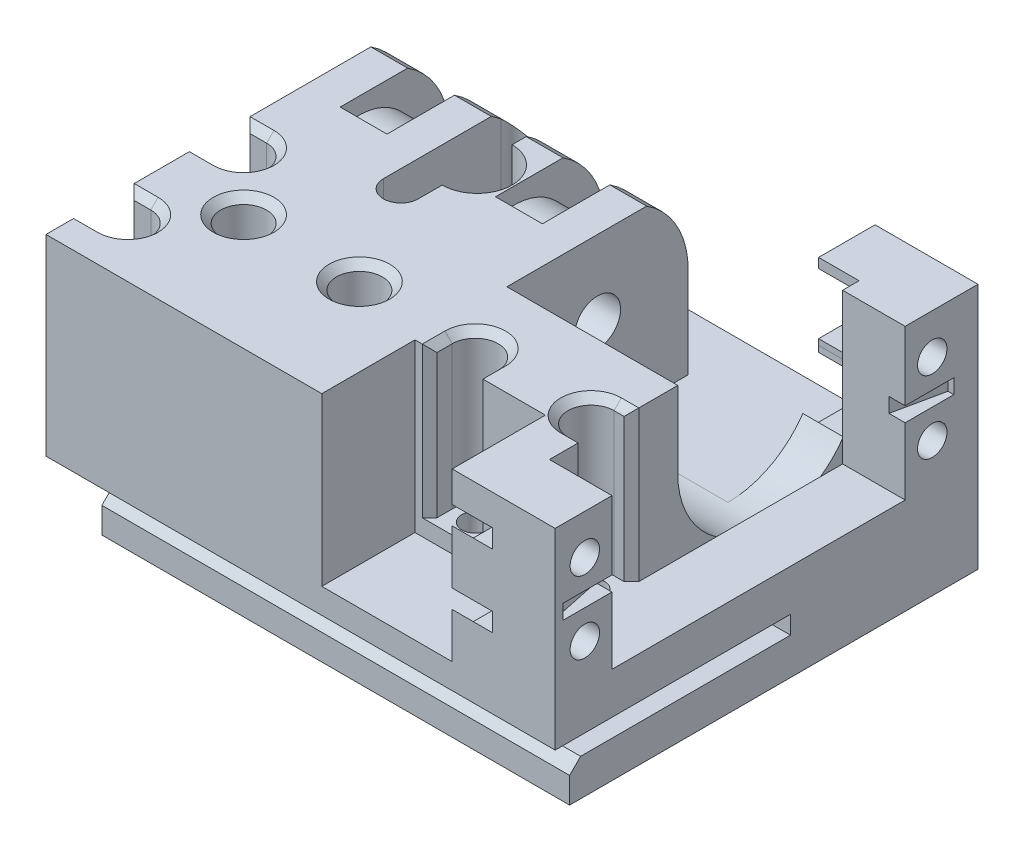
from build123d import *

# Parameters (mm, degrees)
SKETCH3_R                      = 3.175
BOSS_EXTRUDE1_DEPTH            = 19.05
SKETCH4_W                      = 83.82
SKETCH4_H                      = 19.05
BOSS_EXTRUDE2_DEPTH            = 32.24022
SKETCH5_W                      = 18.27022
SKETCH5_H                      = 5.345
CUT_EXTRUDE1_DEPTH             = 102.496990436
SKETCH6_W                      = 18.27022
SKETCH6_H                      = 20.32
CUT_EXTRUDE2_DEPTH             = 86.487406486
CUT_EXTRUDE3_REACH             = 87.958
SKETCH7_W                      = 26.743216354
SKETCH7_H                      = 34.182432708
CUT_EXTRUDE3_DIRECTION_2_DEPTH = 2.54
CUT_EXTRUDE4_DEPTH             = 91.51042864
SKETCH9_R                      = 4.826
CUT_EXTRUDE5_DEPTH             = 10.53
SKETCH10_W                     = 14.224
SKETCH10_H                     = 63.5
BOSS_EXTRUDE3_DEPTH            = 25.4
SKETCH11_W                     = 40.50800001
SKETCH11_H                     = 23.485136833
CUT_EXTRUDE6_DEPTH             = 8.636
CUT_EXTRUDE7_DEPTH             = 5.588
CUT_EXTRUDE8_DEPTH             = 99.107882225
SKETCH15_W                     = 52.07
SKETCH15_H                     = 26.53
BOSS_EXTRUDE4_DEPTH            = 18.01622
DELETEFACE1_OUTLINE_W          = 4.04622
DELETEFACE1_OUTLINE_H          = 6.35
DELETEFACE1_DEPTH              = 5.345
CUT_EXTRUDE9_START             = -18.01622
SKETCH17_W                     = 12.876
SKETCH17_H                     = 23.054
CUT_EXTRUDE9_DEPTH             = 18.01622
CUT_EXTRUDE10_DEPTH            = 60.568280192
CUT_EXTRUDE11_START            = -5.08
SKETCH23_W                     = 6.477
SKETCH23_H                     = 24.765
CUT_EXTRUDE11_DEPTH            = 16.37
SKETCH24_W                     = 18.01622
SKETCH24_H                     = 5.976
SKETCH24_W_2                   = 6.477
SKETCH24_W_3                   = 4.826
SKETCH24_W_4                   = 4.064
CUT_EXTRUDE12_DEPTH            = 20.832
CUT_EXTRUDE13_START            = -5.08
CUT_EXTRUDE13_DEPTH            = 6.477
CUT_EXTRUDE14_START            = -11.557
CUT_EXTRUDE14_DEPTH            = 6.477
CUT_EXTRUDE15_DEPTH            = 18.01622
BOSS_EXTRUDE5_REACH            = 74.428
SKETCH29_R                     = 7.239
SKETCH30_R                     = 3.175
CUT_EXTRUDE16_DEPTH            = 20.784000066
SKETCH31_R                     = 1.85
CUT_EXTRUDE17_DEPTH            = 5.745999934
CUT_EXTRUDE18_DEPTH            = 7.366
SKETCH33_W                     = 7.698188609
SKETCH33_H                     = 8.382
CUT_EXTRUDE19_DEPTH            = 6.858
CHAMFER1_SIZE                  = 1.016
CUT_EXTRUDE20_DEPTH            = 1.651
CUT_EXTRUDE20_DEPTH_BACK       = 0.381
CUT_EXTRUDE21_REACH            = 85.932
SKETCH35_R                     = 2.032
CUT_EXTRUDE22_DEPTH            = 5.588
DRAFT1_START                   = -19.05
DRAFT1_DEPTH                   = 5.08
DRAFT1_START_2                 = -7.493
DRAFT1_2_DEPTH                 = 5.08
DRAFT1_START_3                 = 2.413
DRAFT1_3_DEPTH                 = 5.08
DRAFT1_START_4                 = 13.97
DRAFT1_4_DEPTH                 = 5.08


# Read off the part's stored shape, not the designer's step: DeleteFace1, Draft1
with BuildPart() as part:
    # Sketch3 → Boss-Extrude1 (new, symmetric)
    with BuildSketch(Plane(origin=(0, 0, 0), x_dir=(0, 0, -1), z_dir=(1, 0, 0))):
        Polygon((-63.5, 5.345), (-63.5, -13.705), (20.32, -13.705), (20.32, 5.345), (13.97, 5.345), (13.97, 25.4), (-38.1, 25.4), (-38.1, 5.345), align=None)
        with Locations(Location((0, 14.87, 0), (0, 0, 180))):
            Circle(SKETCH3_R, mode=Mode.SUBTRACT)
    extrude(amount=BOSS_EXTRUDE1_DEPTH, both=True)

    # Sketch4 → Boss-Extrude2 (add)
    with BuildSketch(Plane(origin=(19.05, 0, 0), x_dir=(0, 0, -1), z_dir=(1, 0, 0))):
        with Locations((-21.59, -4.18)):
            Rectangle(SKETCH4_W, SKETCH4_H)
    extrude(amount=BOSS_EXTRUDE2_DEPTH)

    # Sketch5 → Cut-Extrude1 (cut, through all)
    with BuildSketch(Plane.XY.offset(63.5)):
        with Locations((42.15511, 2.6725)):
            Rectangle(SKETCH5_W, SKETCH5_H)
    extrude(amount=-CUT_EXTRUDE1_DEPTH, mode=Mode.SUBTRACT)

    # Sketch6 → Cut-Extrude2 (cut, through all)
    with BuildSketch(Plane(origin=(0, 0, 0), x_dir=(1, 0, 0), z_dir=(0, 1, 0))):
        with Locations((42.15511, -53.34)):
            Rectangle(SKETCH6_W, SKETCH6_H)
    extrude(amount=-CUT_EXTRUDE2_DEPTH, mode=Mode.SUBTRACT)

    # Cut-Extrude3: up to this face of the body (flat: up to its plane)
    cut_extrude3_end = Plane(part.part.faces().sort_by_distance((19.05, 15.388215846, 12.442336691))[0])
    # Sketch7 → Cut-Extrude3 (cut, up to the picked face)
    with BuildSketch(Plane(origin=(33.02, 0, 0), x_dir=(0, 0, -1), z_dir=(1, 0, 0)), mode=Mode.PRIVATE) as cut_extrude3_sk1:
        with Locations((-2.195608177, 14.87)):
            Rectangle(SKETCH7_W, SKETCH7_H)
    cut_extrude3_tool1 = split(extrude(cut_extrude3_sk1.sketch, amount=-CUT_EXTRUDE3_REACH, mode=Mode.PRIVATE), bisect_by=cut_extrude3_end, keep=Keep.BOTH, mode=Mode.PRIVATE)
    add(cut_extrude3_tool1.solids().sort_by(Axis((33.02, 14.87, 2.195608), (-1, 0, 0)))[0], mode=Mode.SUBTRACT)

    # Sketch7 → Cut-Extrude3 direction 2 (cut)
    with BuildSketch(Plane(origin=(33.02, 0, 0), x_dir=(0, 0, -1), z_dir=(1, 0, 0))):
        with Locations((-2.195608177, 14.87)):
            Rectangle(SKETCH7_W, SKETCH7_H)
    extrude(amount=CUT_EXTRUDE3_DIRECTION_2_DEPTH, mode=Mode.SUBTRACT)

    # Sketch8 → Cut-Extrude4 (cut, through all)
    with BuildSketch(Plane(origin=(0, 25.4, 0), x_dir=(1, 0, 0), z_dir=(0, 1, 0))):
        with BuildLine():
            Line((2.413, 8.128), (2.413, -8.128))
            ThreePointArc((2.413, -8.128), (0, -10.541), (-2.413, -8.128))
            Line((-2.413, -8.128), (-2.413, 8.128))
            ThreePointArc((-2.413, 8.128), (0, 10.541), (2.413, 8.128))
        make_face()
    extrude(amount=-CUT_EXTRUDE4_DEPTH, mode=Mode.SUBTRACT)

    # Sketch9 → Cut-Extrude5 (cut)
    with BuildSketch(Plane(origin=(0, 25.4, 0), x_dir=(1, 0, 0), z_dir=(0, 1, 0))):
        with Locations((2.413, 0)):
            Circle(SKETCH9_R)
    extrude(amount=-CUT_EXTRUDE5_DEPTH, mode=Mode.SUBTRACT)

    # Sketch10 → Boss-Extrude3 (add)
    with BuildSketch(Plane(origin=(0, 0, 0), x_dir=(1, 0, 0), z_dir=(0, 1, 0))):
        with Locations((44.17822, -11.43)):
            Rectangle(SKETCH10_W, SKETCH10_H)
    extrude(amount=BOSS_EXTRUDE3_DEPTH)

    # Sketch11 → Cut-Extrude6 (cut)
    with BuildSketch(Plane(origin=(51.29022, 0, 0), x_dir=(0, 0, -1), z_dir=(1, 0, 0))):
        with Locations((-9.999999939, 16.358568351)):
            Rectangle(SKETCH11_W, SKETCH11_H)
    extrude(amount=-CUT_EXTRUDE6_DEPTH, mode=Mode.SUBTRACT)

    # Sketch12 → Cut-Extrude7 (cut)
    with BuildSketch(Plane.ZY.offset(-37.06622)):
        with BuildLine():
            Line((12.524, 14.87), (12.524, 39.918))
            Line((12.524, 39.918), (-12.524, 39.918))
            Line((-12.524, 39.918), (-12.524, 14.87))
            ThreePointArc((-12.524, 14.87), (0, 2.346), (12.524, 14.87))
        make_face()
    extrude(amount=-CUT_EXTRUDE7_DEPTH, mode=Mode.SUBTRACT)

    # Sketch14 → Cut-Extrude8 (cut, through all)
    with BuildSketch(Plane.ZY.offset(19.05)):
        Polygon((5.592, -1.13), (5.592, -3.63), (34.576, -3.63), (36.1, -5.154), (36.1, -8.71), (-24.526326305, -8.71), (-24.526326305, -20.708004014), (63.5, -20.708004014), (63.5, 33.786418234), (38.1, 33.786418234), (38.1, -1.13), align=None)
    extrude(amount=-CUT_EXTRUDE8_DEPTH, mode=Mode.SUBTRACT)

    # Sketch15 → Boss-Extrude4 (add)
    with BuildSketch(Plane(origin=(19.05, 0, 0), x_dir=(0, 0, -1), z_dir=(1, 0, 0))):
        with Locations((-12.065, 12.135)):
            Rectangle(SKETCH15_W, SKETCH15_H)
    extrude(amount=BOSS_EXTRUDE4_DEPTH)

    # DeleteFace1 outline → DeleteFace1 (add)
    with BuildSketch(Plane(origin=(0, 0, 0), x_dir=(1, 0, 0), z_dir=(0, 1, 0))):
        with Locations((35.04311, 17.145)):
            Rectangle(DELETEFACE1_OUTLINE_W, DELETEFACE1_OUTLINE_H)
    extrude(amount=DELETEFACE1_DEPTH)

    # Sketch17 → Cut-Extrude9 (cut)
    with BuildSketch(Plane(origin=(37.06622, 0, 0), x_dir=(0, 0, -1), z_dir=(1, 0, 0)).offset(CUT_EXTRUDE9_START)):
        with BuildLine():
            Line((-12.524, 25.4), (38.058416854, 25.4))
            Line((38.058416854, 25.4), (38.058416854, 2.346))
            Line((38.058416854, 2.346), (0, 2.346))
            ThreePointArc((0, 2.346), (-8.855805328, 6.014194672), (-12.524, 14.87))
            Line((-12.524, 14.87), (-12.524, 25.4))
        make_face()
        with Locations((-31.662, 13.873)):
            Rectangle(SKETCH17_W, SKETCH17_H)
    extrude(amount=CUT_EXTRUDE9_DEPTH, mode=Mode.SUBTRACT)

    # Sketch18 → Cut-Extrude10 (cut, through all)
    with BuildSketch(Plane(origin=(19.05, 0, 0), x_dir=(0, 0, -1), z_dir=(1, 0, 0))):
        with BuildLine():
            Line((12.524, 14.87), (12.524, 2.346))
            Line((12.524, 2.346), (28.306113681, 2.346))
            Line((28.306113681, 2.346), (28.306113681, 27.20416072))
            Line((28.306113681, 27.20416072), (2.172338676, 27.20416072))
            ThreePointArc((2.172338676, 27.20416072), (9.593147179, 22.921217499), (12.524, 14.87))
        make_face()
    extrude(amount=-CUT_EXTRUDE10_DEPTH, mode=Mode.SUBTRACT)

    # Sketch23 → Cut-Extrude11 (cut)
    with BuildSketch(Plane(origin=(0, 25.4, 0), x_dir=(1, 0, 0), z_dir=(0, 1, 0)).offset(CUT_EXTRUDE11_START)):
        with Locations((-10.7315, -20.6375)):
            Rectangle(SKETCH23_W, SKETCH23_H)
        with BuildLine():
            Line((-2.413, -15.221833942), (-2.413, -33.02))
            Line((-2.413, -33.02), (2.413, -33.02))
            Line((2.413, -33.02), (2.413, -15.221833942))
            ThreePointArc((2.413, -15.221833942), (0, -15.621), (-2.413, -15.221833942))
        make_face()
        with Locations((10.7315, -20.6375)):
            Rectangle(SKETCH23_W, SKETCH23_H)
    extrude(amount=-CUT_EXTRUDE11_DEPTH, mode=Mode.SUBTRACT)

    # Sketch24 → Cut-Extrude12 (cut)
    with BuildSketch(Plane(origin=(0, 0, -20.32), x_dir=(-1, 0, 0), z_dir=(0, 0, -1))):
        with Locations((-28.05811, -5.722)):
            Rectangle(SKETCH24_W, SKETCH24_H)
        with Locations((-10.7315, -5.722)):
            Rectangle(SKETCH24_W_2, SKETCH24_H)
        with Locations((0, -5.722)):
            Rectangle(SKETCH24_W_3, SKETCH24_H)
        with Locations((10.7315, -5.722)):
            Rectangle(SKETCH24_W_2, SKETCH24_H)
        with Locations((-44.17822, -5.722)):
            Rectangle(SKETCH24_W_4, SKETCH24_H)
    extrude(amount=-CUT_EXTRUDE12_DEPTH, mode=Mode.SUBTRACT)

    # Sketch25 → Cut-Extrude13 (cut)
    with BuildSketch(Plane.ZY.offset(19.05).offset(CUT_EXTRUDE13_START)):
        with BuildLine():
            Line((-2.54, 2.346), (-12.524, 2.346))
            Line((-12.524, 2.346), (-12.524, 30.242497428))
            Line((-12.524, 30.242497428), (2.54, 27.697802569))
            Line((2.54, 27.697802569), (2.54, 22.724516217))
            ThreePointArc((2.54, 22.724516217), (-7.854516217, 17.41), (-2.54, 7.015483783))
            Line((-2.54, 7.015483783), (-2.54, 2.346))
        make_face()
        with BuildLine():
            Line((2.54, 7.015483783), (2.54, 3.95))
            Line((2.54, 3.95), (9.525, 3.95))
            Line((9.525, 3.95), (9.525, 20.32))
            Line((9.525, 20.32), (6.200203626, 20.32))
            ThreePointArc((6.200203626, 20.32), (7.959291915, 12.680320296), (2.54, 7.015483783))
        make_face()
    extrude(amount=-CUT_EXTRUDE13_DEPTH, mode=Mode.SUBTRACT)

    # Sketch26 → Cut-Extrude14 (cut)
    with BuildSketch(Plane(origin=(19.05, 0, 0), x_dir=(0, 0, -1), z_dir=(1, 0, 0)).offset(CUT_EXTRUDE14_START)):
        with BuildLine():
            Line((12.524, 30.242497428), (-2.54, 27.697802569))
            Line((-2.54, 27.697802569), (-2.54, 22.724516217))
            ThreePointArc((-2.54, 22.724516217), (7.854516217, 17.41), (2.54, 7.015483783))
            Line((2.54, 7.015483783), (2.54, 2.346))
            Line((2.54, 2.346), (12.524, 2.346))
            Line((12.524, 2.346), (12.524, 30.242497428))
        make_face()
    extrude(amount=CUT_EXTRUDE14_DEPTH, mode=Mode.SUBTRACT)

    # Sketch27 → Cut-Extrude15 (cut)
    with BuildSketch(Plane.ZY.offset(-37.06622)):
        with BuildLine():
            Line((17.604, 14.87), (17.604, 20.32))
            Line((17.604, 20.32), (20.144, 20.32))
            Line((20.144, 20.32), (20.144, 3.95))
            Line((20.144, 3.95), (13.80776651, 3.95))
            ThreePointArc((13.80776651, 3.95), (16.627879264, 9.089476911), (17.604, 14.87))
        make_face()
    extrude(amount=CUT_EXTRUDE15_DEPTH, mode=Mode.SUBTRACT)

    # Boss-Extrude5: up to this face of the body (flat: up to its plane)
    boss_extrude5_end = Plane(part.part.faces().sort_by_distance((28.05811, 2.346, 31.662))[0])
    # Sketch29 → Boss-Extrude5 (add, up to the picked face)
    with BuildSketch(Plane(origin=(0, 25.4, 0), x_dir=(1, 0, 0), z_dir=(0, 1, 0)), mode=Mode.PRIVATE) as boss_extrude5_sk1:
        with Locations((8.25, -22.1)):
            Circle(SKETCH29_R)
    boss_extrude5_tool1 = split(extrude(boss_extrude5_sk1.sketch, amount=-BOSS_EXTRUDE5_REACH, mode=Mode.PRIVATE), bisect_by=boss_extrude5_end, keep=Keep.BOTH, mode=Mode.PRIVATE)
    # Sketch29 → Boss-Extrude5 (add, up to the picked face)
    with BuildSketch(Plane(origin=(0, 25.4, 0), x_dir=(1, 0, 0), z_dir=(0, 1, 0)), mode=Mode.PRIVATE) as boss_extrude5_sk2:
        with BuildLine():
            Line((-19.05, -7.65693233), (-19.05, -20.54306767))
            ThreePointArc((-19.05, -20.54306767), (-17.052292081, -21.220895754), (-14.943988181, -21.293988181))
            ThreePointArc((-14.943988181, -21.293988181), (-14.989, -22.1), (-14.943988181, -22.906011819))
            ThreePointArc((-14.943988181, -22.906011819), (-17.052292081, -22.979104246), (-19.05, -23.65693233))
            Line((-19.05, -23.65693233), (-19.05, -36.54306767))
            ThreePointArc((-19.05, -36.54306767), (-11.635625886, -36.056093237), (-8.556011819, -29.293988181))
            ThreePointArc((-8.556011819, -29.293988181), (-0.511, -22.1), (-8.556011819, -14.906011819))
            ThreePointArc((-8.556011819, -14.906011819), (-11.635625886, -8.143906763), (-19.05, -7.65693233))
        make_face()
    boss_extrude5_tool2 = split(extrude(boss_extrude5_sk2.sketch, amount=-BOSS_EXTRUDE5_REACH, mode=Mode.PRIVATE), bisect_by=boss_extrude5_end, keep=Keep.BOTH, mode=Mode.PRIVATE)
    # Sketch29 → Boss-Extrude5 (add, up to the picked face)
    with BuildSketch(Plane(origin=(0, 25.4, 0), x_dir=(1, 0, 0), z_dir=(0, 1, 0)), mode=Mode.PRIVATE) as boss_extrude5_sk3:
        with BuildLine():
            Line((42.65422, -25.224), (42.65422, -15.2719075))
            ThreePointArc((42.65422, -15.2719075), (34.863256938, -17.264080214), (33.719782163, -25.224))
            Line((33.719782163, -25.224), (42.65422, -25.224))
        make_face()
    boss_extrude5_tool3 = split(extrude(boss_extrude5_sk3.sketch, amount=-BOSS_EXTRUDE5_REACH, mode=Mode.PRIVATE), bisect_by=boss_extrude5_end, keep=Keep.BOTH, mode=Mode.PRIVATE)
    # Sketch29 → Boss-Extrude5 (add, up to the picked face)
    with BuildSketch(Plane(origin=(0, 25.4, 0), x_dir=(1, 0, 0), z_dir=(0, 1, 0)), mode=Mode.PRIVATE) as boss_extrude5_sk4:
        with BuildLine():
            Line((17.719782163, -25.224), (30.780217837, -25.224))
            ThreePointArc((30.780217837, -25.224), (24.25, -14.861), (17.719782163, -25.224))
        make_face()
    boss_extrude5_tool4 = split(extrude(boss_extrude5_sk4.sketch, amount=-BOSS_EXTRUDE5_REACH, mode=Mode.PRIVATE), bisect_by=boss_extrude5_end, keep=Keep.BOTH, mode=Mode.PRIVATE)
    add(boss_extrude5_tool1.solids().sort_by(Axis((8.25, 25.4, 22.1), (0, -1, 0)))[0])
    add(boss_extrude5_tool2.solids().sort_by(Axis((-11.781136, 25.4, 22.1), (0, -1, 0)))[0])
    add(boss_extrude5_tool3.solids().sort_by(Axis((38.266183, 25.4, 20.482323), (0, -1, 0)))[0])
    add(boss_extrude5_tool4.solids().sort_by(Axis((24.25, 25.4, 20.627742), (0, -1, 0)))[0])

    # Sketch30 → Cut-Extrude16 (cut)
    with BuildSketch(Plane(origin=(0, 25.4, 0), x_dir=(1, 0, 0), z_dir=(0, 1, 0))):
        with Locations(Location((-7.75, -22.1, 0), (0, 0, 270))):
            Circle(SKETCH30_R)
        with Locations(Location((8.25, -22.1, 0), (0, 0, 270))):
            Circle(SKETCH30_R)
        with BuildLine():
            Line((-15.75, -17.275), (-24.660137831, -17.275))
            ThreePointArc((-24.660137831, -17.275), (-27.835137831, -14.1), (-24.660137831, -10.925))
            Line((-24.660137831, -10.925), (-15.75, -10.925))
            ThreePointArc((-15.75, -10.925), (-12.575, -14.1), (-15.75, -17.275))
        make_face()
        with BuildLine():
            Line((-15.75, -33.275), (-24.156487658, -33.275))
            ThreePointArc((-24.156487658, -33.275), (-27.331487658, -30.1), (-24.156487658, -26.925))
            Line((-24.156487658, -26.925), (-15.75, -26.925))
            ThreePointArc((-15.75, -26.925), (-12.575, -30.1), (-15.75, -33.275))
        make_face()
        with BuildLine():
            Line((27.425, -22.1), (27.425, -30.1))
            ThreePointArc((27.425, -30.1), (24.25, -33.275), (21.075, -30.1))
            Line((21.075, -30.1), (21.075, -22.1))
            ThreePointArc((21.075, -22.1), (24.25, -18.925), (27.425, -22.1))
        make_face()
        with BuildLine():
            Line((40.25, -18.925), (45.803319647, -18.925))
            ThreePointArc((45.803319647, -18.925), (48.978319647, -22.1), (45.803319647, -25.275))
            Line((45.803319647, -25.275), (40.25, -25.275))
            ThreePointArc((40.25, -25.275), (37.075, -22.1), (40.25, -18.925))
        make_face()
    extrude(amount=-CUT_EXTRUDE16_DEPTH, mode=Mode.SUBTRACT)

    # Sketch31 → Cut-Extrude17 (cut)
    with BuildSketch(Plane(origin=(0, 4.615999934, 0), x_dir=(1, 0, 0), z_dir=(0, 1, 0))):
        with Locations(Location((40.25, -22.1, 0), (0, 0, 270))):
            Circle(SKETCH31_R)
        with Locations(Location((24.25, -22.1, 0), (0, 0, 270))):
            Circle(SKETCH31_R)
        with Locations(Location((8.25, -22.1, 0), (0, 0, 270))):
            Circle(SKETCH31_R)
        with Locations(Location((-7.75, -22.1, 0), (0, 0, 270))):
            Circle(SKETCH31_R)
        with Locations(Location((-15.75, -14.1, 0), (0, 0, 270))):
            Circle(SKETCH31_R)
        with Locations(Location((-15.75, -30.1, 0), (0, 0, 270))):
            Circle(SKETCH31_R)
    extrude(amount=-CUT_EXTRUDE17_DEPTH, mode=Mode.SUBTRACT)

    # Sketch32 → Cut-Extrude18 (cut)
    with BuildSketch(Plane(origin=(0, -3.63, 0), x_dir=(1, 0, 0), z_dir=(0, 1, 0))):
        Polygon((-5.330325022, -17.909), (-10.169674978, -17.909), (-12.589349956, -22.1), (-10.169674978, -26.291), (-5.330325022, -26.291), (-2.910650044, -22.1), align=None)
        Polygon((-20.589349956, -14.1), (-18.169674978, -18.291), (-13.330325022, -18.291), (-10.910650044, -14.1), (-13.330325022, -9.909), (-18.169674978, -9.909), align=None)
        Polygon((-18.169674978, -34.291), (-13.330325022, -34.291), (-10.910650044, -30.1), (-13.330325022, -25.909), (-18.169674978, -25.909), (-20.589349956, -30.1), align=None)
        Polygon((13.089349956, -22.1), (10.669674978, -17.909), (5.830325022, -17.909), (3.410650044, -22.1), (5.830325022, -26.291), (10.669674978, -26.291), align=None)
        Polygon((29.089349956, -22.1), (26.669674978, -17.909), (21.830325022, -17.909), (19.410650044, -22.1), (21.830325022, -26.291), (26.669674978, -26.291), align=None)
        Polygon((45.089349956, -22.1), (42.669674978, -17.909), (37.830325022, -17.909), (35.410650044, -22.1), (37.830325022, -26.291), (42.669674978, -26.291), align=None)
    extrude(amount=-CUT_EXTRUDE18_DEPTH, mode=Mode.SUBTRACT)

    # Sketch33 → Cut-Extrude19 (cut)
    with BuildSketch(Plane.XZ.offset(8.71)):
        Polygon((-18.169674978, 25.909), (-13.330325022, 34.291), (-13.330325022, 40.102605085), (-25.867863587, 40.102605085), (-25.867863587, 25.909), align=None)
        with Locations((-22.018769283, 14.1)):
            Rectangle(SKETCH33_W, SKETCH33_H)
    extrude(amount=-CUT_EXTRUDE19_DEPTH, mode=Mode.SUBTRACT)

    # Chamfer1
    chamfer1_edges = [part.edges().sort_by_distance(p)[0] for p in [
        (-19.05, 15.007999967, 17.275),
        (-19.05, 15.007999967, 10.925),
        (-17.4, 25.4, 10.925),
        (-17.4, 25.4, 17.275),
        (-12.575, 25.4, 14.1),
        (27.425, 15.007999967, 25.224),
        (21.075, 15.007999967, 25.224),
        (-19.05, 15.007999967, 33.275),
        (-19.05, 15.007999967, 26.925),
        (-17.4, 25.4, 26.925),
        (-17.4, 25.4, 33.275),
        (-12.575, 25.4, 30.1),
        (-7.75, 25.4, 18.925),
        (8.25, 25.4, 18.925),
        (21.075, 25.4, 23.662),
        (27.425, 25.4, 23.662),
        (24.25, 25.4, 18.925),
        (41.45211, 25.4, 25.275),
        (41.45211, 25.4, 18.925),
        (37.075, 25.4, 22.1),
        (42.65422, 15.007999967, 25.275),
        (42.65422, 15.007999967, 18.925),
    ]]
    chamfer(chamfer1_edges, length=CHAMFER1_SIZE)

    # Sketch34 → Cut-Extrude20 (cut, two sides: drawn at the far end of the back side and taken through both)
    with BuildSketch(Plane(origin=(0, 14.245, 0), x_dir=(1, 0, 0), z_dir=(0, 1, 0)).offset(-CUT_EXTRUDE20_DEPTH_BACK)):
        Polygon((48.858728421, -29.331541325), (54.634333156, -29.331541325), (54.634333156, -36.981), (50.481340867, -36.981), align=None)
        Polygon((54.419424916, 16.981), (50.481340867, 16.981), (48.801251133, 9.060576966), (54.419424916, 9.060576966), align=None)
    extrude(amount=CUT_EXTRUDE20_DEPTH + CUT_EXTRUDE20_DEPTH_BACK, mode=Mode.SUBTRACT)

    # Cut-Extrude21: up to this face of the body (flat: up to its plane)
    cut_extrude21_end = Plane(part.part.faces().sort_by_distance((37.06622, 13.873, 31.662))[0])
    # Sketch35 → Cut-Extrude21 (cut, up to the picked face)
    with BuildSketch(Plane(origin=(51.29022, 0, 0), x_dir=(0, 0, -1), z_dir=(1, 0, 0)), mode=Mode.PRIVATE) as cut_extrude21_sk1:
        with Locations((-34, 19.87)):
            Circle(SKETCH35_R)
    cut_extrude21_tool1 = split(extrude(cut_extrude21_sk1.sketch, amount=-CUT_EXTRUDE21_REACH, mode=Mode.PRIVATE), bisect_by=cut_extrude21_end, keep=Keep.BOTH, mode=Mode.PRIVATE)
    # Sketch35 → Cut-Extrude21 (cut, up to the picked face)
    with BuildSketch(Plane(origin=(51.29022, 0, 0), x_dir=(0, 0, -1), z_dir=(1, 0, 0)), mode=Mode.PRIVATE) as cut_extrude21_sk2:
        with Locations((-34, 9.87)):
            Circle(SKETCH35_R)
    cut_extrude21_tool2 = split(extrude(cut_extrude21_sk2.sketch, amount=-CUT_EXTRUDE21_REACH, mode=Mode.PRIVATE), bisect_by=cut_extrude21_end, keep=Keep.BOTH, mode=Mode.PRIVATE)
    # Sketch35 → Cut-Extrude21 (cut, up to the picked face)
    with BuildSketch(Plane(origin=(51.29022, 0, 0), x_dir=(0, 0, -1), z_dir=(1, 0, 0)), mode=Mode.PRIVATE) as cut_extrude21_sk3:
        with Locations((14, 19.87)):
            Circle(SKETCH35_R)
    cut_extrude21_tool3 = split(extrude(cut_extrude21_sk3.sketch, amount=-CUT_EXTRUDE21_REACH, mode=Mode.PRIVATE), bisect_by=cut_extrude21_end, keep=Keep.BOTH, mode=Mode.PRIVATE)
    # Sketch35 → Cut-Extrude21 (cut, up to the picked face)
    with BuildSketch(Plane(origin=(51.29022, 0, 0), x_dir=(0, 0, -1), z_dir=(1, 0, 0)), mode=Mode.PRIVATE) as cut_extrude21_sk4:
        with Locations((14, 9.87)):
            Circle(SKETCH35_R)
    cut_extrude21_tool4 = split(extrude(cut_extrude21_sk4.sketch, amount=-CUT_EXTRUDE21_REACH, mode=Mode.PRIVATE), bisect_by=cut_extrude21_end, keep=Keep.BOTH, mode=Mode.PRIVATE)
    add(cut_extrude21_tool1.solids().sort_by(Axis((51.29022, 19.87, 34), (-1, 0, 0)))[0], mode=Mode.SUBTRACT)
    add(cut_extrude21_tool2.solids().sort_by(Axis((51.29022, 9.87, 34), (-1, 0, 0)))[0], mode=Mode.SUBTRACT)
    add(cut_extrude21_tool3.solids().sort_by(Axis((51.29022, 19.87, -14), (-1, 0, 0)))[0], mode=Mode.SUBTRACT)
    add(cut_extrude21_tool4.solids().sort_by(Axis((51.29022, 9.87, -14), (-1, 0, 0)))[0], mode=Mode.SUBTRACT)

    # Sketch36 → Cut-Extrude22 (cut)
    with BuildSketch(Plane.ZY.offset(-37.06622)):
        Polygon((-11.580325022, 15.679), (-9.160650044, 19.87), (-11.580325022, 24.061), (-16.419674978, 24.061), (-18.839349956, 19.87), (-16.419674978, 15.679), align=None)
        Polygon((-11.580325022, 5.679), (-9.160650044, 9.87), (-11.580325022, 14.061), (-16.419674978, 14.061), (-18.839349956, 9.87), (-16.419674978, 5.679), align=None)
        Polygon((36.419674978, 15.679), (38.839349956, 19.87), (36.419674978, 24.061), (31.580325022, 24.061), (29.160650044, 19.87), (31.580325022, 15.679), align=None)
        Polygon((36.419674978, 5.679), (38.839349956, 9.87), (36.419674978, 14.061), (31.580325022, 14.061), (29.160650044, 9.87), (31.580325022, 5.679), align=None)
    extrude(amount=-CUT_EXTRUDE22_DEPTH, mode=Mode.SUBTRACT)

    # Draft1 outline → Draft1 (add)
    with BuildSketch(Plane.YZ.offset(DRAFT1_START)):
        Polygon((-8.71, -20.32), (-8.71, 0.512), (-15.078981556, -20.32), align=None)
    extrude(amount=DRAFT1_DEPTH)

    # Draft1 2 outline → Draft1 2 (add)
    with BuildSketch(Plane.YZ.offset(DRAFT1_START_2)):
        Polygon((-8.71, -20.32), (-8.71, 0.512), (-15.078981556, -20.32), align=None)
    extrude(amount=DRAFT1_2_DEPTH)

    # Draft1 3 outline → Draft1 3 (add)
    with BuildSketch(Plane.YZ.offset(DRAFT1_START_3)):
        Polygon((-8.71, -20.32), (-8.71, 0.512), (-15.078981556, -20.32), align=None)
    extrude(amount=DRAFT1_3_DEPTH)

    # Draft1 4 outline → Draft1 4 (add)
    with BuildSketch(Plane.YZ.offset(DRAFT1_START_4)):
        Polygon((-8.71, -20.32), (-8.71, 0.512), (-15.078981556, -20.32), align=None)
    extrude(amount=DRAFT1_4_DEPTH)


solid = part.part
